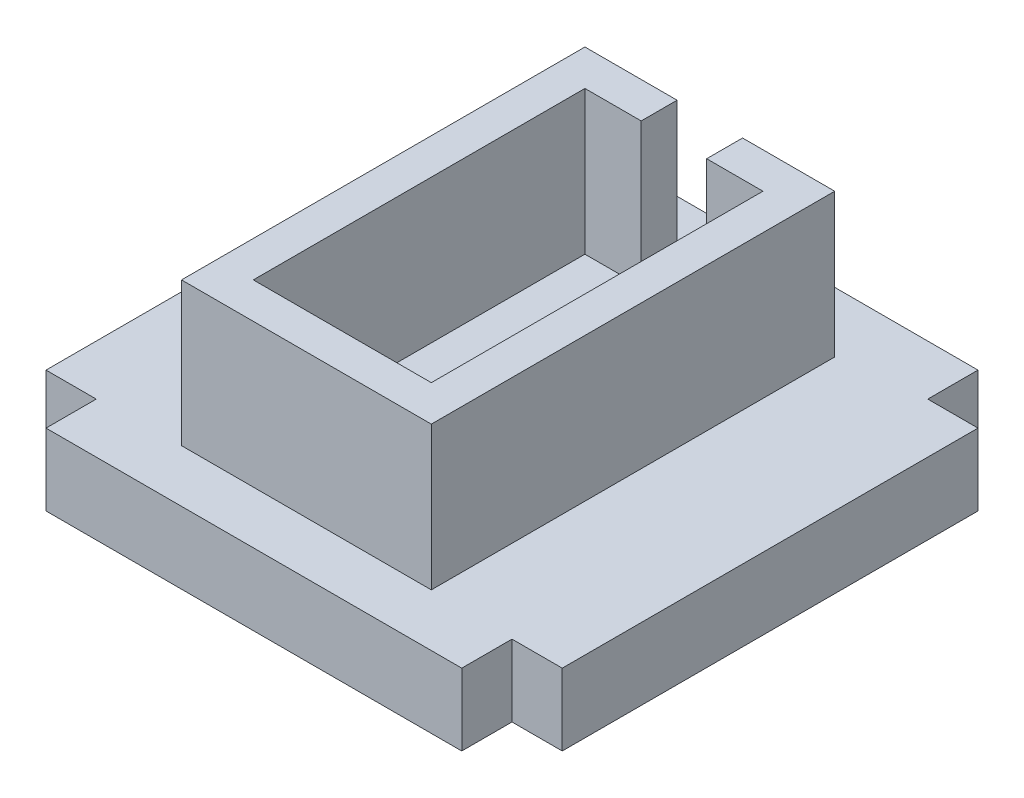
from build123d import *

# Parameters (mm, degrees)
BOSS_EXTRUDE18_DEPTH = 5
BOSS_EXTRUDE19_DEPTH = 10


with BuildPart() as part:
    # Sketch21 → Boss-Extrude18 (new body)
    with BuildSketch(Plane(origin=(0, 0, 0), x_dir=(1, 0, 0), z_dir=(0, 1, 0))):
        Polygon((0, 17.98), (-14.48, 17.98), (-14.48, 14.48), (-17.98, 14.48), (-17.98, 0), (-17.98, -14.48), (-14.48, -14.48), (-14.48, -17.98), (0, -17.98), (14.48, -17.98), (14.48, -14.48), (17.98, -14.48), (17.98, 0), (17.98, 14.48), (14.48, 14.48), (14.48, 17.98), align=None)
    extrude(amount=BOSS_EXTRUDE18_DEPTH)

    # Sketch23 → Boss-Extrude19 (add)
    with BuildSketch(Plane(origin=(0, 5, 0), x_dir=(1, 0, 0), z_dir=(0, 1, 0))):
        Polygon((-8.7, 13.78), (-2.28, 13.78), (-2.28, 11.28), (-6.2, 11.28), (-6.2, -11.82), (6.2, -11.82), (6.2, 11.28), (2.28, 11.28), (2.28, 13.78), (8.7, 13.78), (8.7, -14.32), (-8.7, -14.32), align=None)
    extrude(amount=BOSS_EXTRUDE19_DEPTH)


solid = part.part
